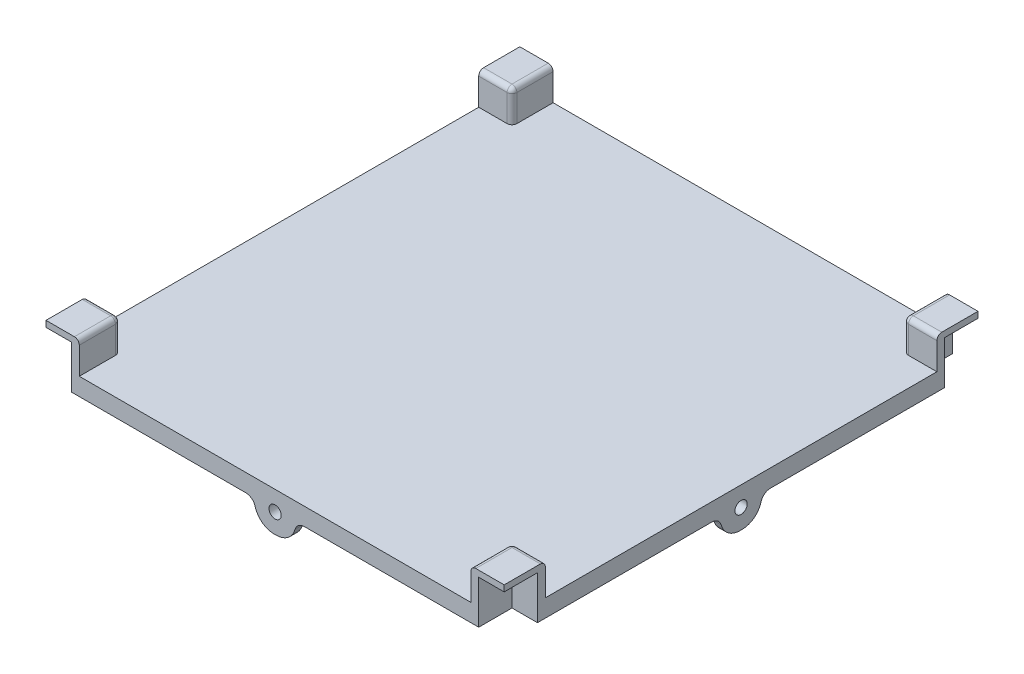
from build123d import *

# Parameters (mm, degrees)
SKETCH2_W                 = 93.6
SKETCH2_H                 = 96.8
BOSS_EXTRUDE2_DEPTH       = 1.6
CUT_EXTRUDE1_DEPTH        = 1.6
CUT_EXTRUDE2_DEPTH        = 1.6
CUT_EXTRUDE3_DEPTH        = 1.6
CUT_EXTRUDE4_DEPTH        = 1.6
SKETCH7_R                 = 15
BOSS_EXTRUDE3_DEPTH       = 1.6
SKETCH8_R                 = 6
CUT_EXTRUDE5_DEPTH        = 1.6
FILLET1_R                 = 2
FILLET2_R                 = 2
SKETCH17_W                = 43.6
SKETCH17_H                = 1.6
BOSS_EXTRUDE4_DEPTH       = 8
CUT_EXTRUDE14_DEPTH       = 1.6
CUT_EXTRUDE15_DEPTH       = 1.6
SKETCH21_W                = 1.6
SKETCH21_H                = 43.6
BOSS_EXTRUDE5_DEPTH       = 8
SKETCH22_W                = 1.6
SKETCH22_H                = 43.6
BOSS_EXTRUDE6_DEPTH       = 8
SKETCH23_W                = 43.6
SKETCH23_H                = 1.6
BOSS_EXTRUDE7_DEPTH       = 8
CUT_EXTRUDE16_DEPTH       = 100
CUT_EXTRUDE17_DEPTH       = 100
CUT_EXTRUDE18_DEPTH       = 100
CUT_EXTRUDE19_DEPTH       = 100
SKETCH28_R                = 2.5
BOSS_EXTRUDE8_DEPTH       = 1.4
BOSS_EXTRUDE9_START       = 1.4
SKETCH29_R                = 2.5
BOSS_EXTRUDE9_DEPTH       = 1.4
SKETCH30_R                = 2.5
BOSS_EXTRUDE10_DEPTH      = 1.4
BOSS_EXTRUDE11_START      = 1.4
SKETCH31_R                = 2.5
BOSS_EXTRUDE11_DEPTH      = 1.4
M3X0_5_TAPPED_HOLE1_D     = 2.5
M3X0_5_TAPPED_HOLE2_D     = 2.5
M3X0_5_TAPPED_HOLE2_DEPTH = 8.5
M3X0_5_TAPPED_HOLE2_TIP   = 0.751075774
M3X0_5_TAPPED_HOLE3_D     = 2.5
M3X0_5_TAPPED_HOLE3_DEPTH = 8.5
M3X0_5_TAPPED_HOLE3_TIP   = 0.751075774
FILLET5_R                 = 5
FILLET6_R                 = 5
FILLET7_R                 = 5
SKETCH39_W                = 50
SKETCH39_H                = 2
CUT_EXTRUDE20_DEPTH       = 100
SKETCH40_W                = 50
SKETCH40_H                = 2
CUT_EXTRUDE21_DEPTH       = 100
FILLET10_R                = 5
FILLET11_R                = 5
BOSS_EXTRUDE12_DEPTH      = 6.5
FILLET12_R                = 1
BOSS_EXTRUDE13_DEPTH      = 6.5
FILLET13_R                = 1
BOSS_EXTRUDE14_DEPTH      = 6.5
BOSS_EXTRUDE15_DEPTH      = 6.5
FILLET14_R                = 1
SKETCH46_W                = 10
SKETCH46_H                = 6
CUT_EXTRUDE23_DEPTH       = 100
SKETCH47_W                = 10
SKETCH47_H                = 6
CUT_EXTRUDE24_DEPTH       = 100
SKETCH48_W                = 10
SKETCH48_H                = 6
CUT_EXTRUDE25_DEPTH       = 100
SKETCH49_W                = 10
SKETCH49_H                = 6
CUT_EXTRUDE26_DEPTH       = 100
CHAMFER1_SIZE             = 5
FILLET15_R                = 5
FILLET16_R                = 5
FILLET17_R                = 5
SKETCH51_W                = 6.8
SKETCH51_H                = 1.25
BOSS_EXTRUDE16_DEPTH      = 5.2
SKETCH52_W                = 6.8
SKETCH52_H                = 1.25
BOSS_EXTRUDE17_DEPTH      = 5.2
SKETCH53_W                = 5.2
SKETCH53_H                = 1.25
BOSS_EXTRUDE18_DEPTH      = 6.8
SKETCH54_W                = 6.8
SKETCH54_H                = 1.25
BOSS_EXTRUDE19_DEPTH      = 5.2
SKETCH55_W                = 5.452266971
SKETCH55_H                = 7.312215573
CUT_EXTRUDE27_DEPTH       = 1.6
SKETCH56_W                = 7.42696381
SKETCH56_H                = 8.768462259
CUT_EXTRUDE28_DEPTH       = 1.6
SKETCH57_W                = 6.622712937
SKETCH57_H                = 11.132324922
CUT_EXTRUDE29_DEPTH       = 1.6
SKETCH58_W                = 8.920588643
SKETCH58_H                = 11.870937258
CUT_EXTRUDE30_DEPTH       = 1.6
SKETCH60_W                = 93.6
SKETCH60_H                = 6
CUT_EXTRUDE31_DEPTH       = 100
BOSS_EXTRUDE20_DEPTH      = 8
SKETCH64_W                = 41.3
SKETCH64_H                = 6
CUT_EXTRUDE32_DEPTH       = 100
SKETCH65_W                = 41.3
SKETCH65_H                = 6
CUT_EXTRUDE33_DEPTH       = 100
SKETCH66_W                = 37.6
SKETCH66_H                = 6
CUT_EXTRUDE34_DEPTH       = 100
SKETCH68_W                = 37.6
SKETCH68_H                = 6
CUT_EXTRUDE35_DEPTH       = 100
FILLET19_R                = 2
SKETCH73_R                = 2.5
BOSS_EXTRUDE21_DEPTH      = 1.4
SKETCH74_R                = 2.5
BOSS_EXTRUDE22_DEPTH      = 1.4
BOSS_EXTRUDE23_START      = 1.4
SKETCH75_R                = 2.5
BOSS_EXTRUDE23_DEPTH      = 1.4
SKETCH76_R                = 2.5
BOSS_EXTRUDE24_DEPTH      = 1.4
SKETCH77_W                = 8
SKETCH77_H                = 1.6
CUT_EXTRUDE40_DEPTH       = 100
SKETCH79_W                = 8
SKETCH79_H                = 1.6
CUT_EXTRUDE41_DEPTH       = 100
FILLET20_R                = 4
M3X0_5_TAPPED_HOLE4_D     = 2.5
M3X0_5_TAPPED_HOLE4_DEPTH = 8.5
M3X0_5_TAPPED_HOLE4_TIP   = 0.751075774
M3X0_5_TAPPED_HOLE5_D     = 2.5
M3X0_5_TAPPED_HOLE5_DEPTH = 8.5
M3X0_5_TAPPED_HOLE5_TIP   = 0.751075774
M3X0_5_TAPPED_HOLE6_D     = 2.5
M3X0_5_TAPPED_HOLE6_DEPTH = 8.5
M3X0_5_TAPPED_HOLE6_TIP   = 0.751075774
M3X0_5_TAPPED_HOLE7_D     = 2.5
M3X0_5_TAPPED_HOLE7_DEPTH = 8.5
M3X0_5_TAPPED_HOLE7_TIP   = 0.751075774
SKETCH88_W                = 75.688433258
SKETCH88_H                = 79.83223405
BOSS_EXTRUDE25_DEPTH      = 1.6


with BuildPart() as part:
    # Sketch2 → Boss-Extrude2 (new body)
    with BuildSketch(Plane(origin=(0, 0, 0), x_dir=(1, 0, 0), z_dir=(0, 1, 0))):
        Rectangle(SKETCH2_W, SKETCH2_H)
    extrude(amount=BOSS_EXTRUDE2_DEPTH)

    # Sketch3 → Cut-Extrude1 (cut)
    with BuildSketch(Plane(origin=(0, 1.6, 0), x_dir=(1, 0, 0), z_dir=(0, 1, 0))):
        Polygon((-30.175405763, 38.4), (30.175405763, 38.4), (0, 7.192956433), align=None)
    extrude(amount=-CUT_EXTRUDE1_DEPTH, mode=Mode.SUBTRACT)

    # Sketch4 → Cut-Extrude2 (cut)
    with BuildSketch(Plane(origin=(0, 1.6, 0), x_dir=(1, 0, 0), z_dir=(0, 1, 0))):
        Polygon((-30.175405763, -38.4), (30.175405763, -38.4), (0, -7.192956433), align=None)
    extrude(amount=-CUT_EXTRUDE2_DEPTH, mode=Mode.SUBTRACT)

    # Sketch5 → Cut-Extrude3 (cut)
    with BuildSketch(Plane(origin=(0, 1.6, 0), x_dir=(1, 0, 0), z_dir=(0, 1, 0))):
        Polygon((36.8, 30.865163225), (36.8, -30.865163225), (6.95517275, 0), align=None)
    extrude(amount=-CUT_EXTRUDE3_DEPTH, mode=Mode.SUBTRACT)

    # Sketch6 → Cut-Extrude4 (cut)
    with BuildSketch(Plane(origin=(0, 1.6, 0), x_dir=(1, 0, 0), z_dir=(0, 1, 0))):
        Polygon((-36.8, 30.865163225), (-36.8, -30.865163225), (-6.95517275, 0), align=None)
    extrude(amount=-CUT_EXTRUDE4_DEPTH, mode=Mode.SUBTRACT)

    # Sketch7 → Boss-Extrude3 (add)
    with BuildSketch(Plane(origin=(0, 1.6, 0), x_dir=(1, 0, 0), z_dir=(0, 1, 0))):
        Circle(SKETCH7_R)
    extrude(amount=-BOSS_EXTRUDE3_DEPTH)

    # Sketch8 → Cut-Extrude5 (cut)
    with BuildSketch(Plane(origin=(0, 1.6, 0), x_dir=(1, 0, 0), z_dir=(0, 1, 0))):
        with Locations(Location((0, 0, 0), (0, 0, 270))):
            Circle(SKETCH8_R)
    extrude(amount=-CUT_EXTRUDE5_DEPTH, mode=Mode.SUBTRACT)

    # Fillet1
    fillet1_edges = [part.edges().sort_by_distance(p)[0] for p in [
        (30.175405763, 0.8, -38.4),
        (-30.175405763, 0.8, -38.4),
        (-30.175405763, 0.8, 38.4),
        (30.175405763, 0.8, 38.4),
        (36.8, 0.8, -30.865163225),
        (36.8, 0.8, 30.865163225),
        (-36.8, 0.8, -30.865163225),
        (-36.8, 0.8, 30.865163225),
        (-13.424991499, 0.8, 6.691009135),
        (6.236097449, 0.8, -13.642253795),
        (13.424991499, 0.8, -6.691009135),
        (-6.236097449, 0.8, 13.642253795),
        (-6.236097449, 0.8, -13.642253795),
        (-13.424991499, 0.8, -6.691009135),
        (6.236097449, 0.8, 13.642253795),
        (13.424991499, 0.8, 6.691009135),
    ]]
    fillet(fillet1_edges, radius=FILLET1_R)

    # Fillet2
    fillet2_edges = [part.edges().sort_by_distance(p)[0] for p in [
        (46.8, 0.8, 48.4),
        (-46.8, 0.8, 48.4),
        (-46.8, 0.8, -48.4),
        (46.8, 0.8, -48.4),
    ]]
    fillet(fillet2_edges, radius=FILLET2_R)

    # Sketch17 → Boss-Extrude4 (add)
    with BuildSketch(Plane.XZ):
        with Locations((0, 47.6)):
            Rectangle(SKETCH17_W, SKETCH17_H)
    extrude(amount=BOSS_EXTRUDE4_DEPTH)

    # Sketch18 → Cut-Extrude14 (cut)
    with BuildSketch(Plane.XY.offset(48.4)):
        Polygon((-21.8, 0), (-21.8, -8), (-13.8, -8), align=None)
    extrude(amount=-CUT_EXTRUDE14_DEPTH, mode=Mode.SUBTRACT)

    # Sketch19 → Cut-Extrude15 (cut)
    with BuildSketch(Plane.XY.offset(48.4)):
        Polygon((21.8, 0), (21.8, -8), (13.8, -8), align=None)
    extrude(amount=-CUT_EXTRUDE15_DEPTH, mode=Mode.SUBTRACT)

    # Sketch21 → Boss-Extrude5 (add)
    with BuildSketch(Plane.XZ):
        with Locations((-46, 0)):
            Rectangle(SKETCH21_W, SKETCH21_H)
    extrude(amount=BOSS_EXTRUDE5_DEPTH)

    # Sketch22 → Boss-Extrude6 (add)
    with BuildSketch(Plane.XZ):
        with Locations((46, 0)):
            Rectangle(SKETCH22_W, SKETCH22_H)
    extrude(amount=BOSS_EXTRUDE6_DEPTH)

    # Sketch23 → Boss-Extrude7 (add)
    with BuildSketch(Plane.XZ):
        with Locations((0, -47.6)):
            Rectangle(SKETCH23_W, SKETCH23_H)
    extrude(amount=BOSS_EXTRUDE7_DEPTH)

    # Sketch24 → Cut-Extrude16 (cut)
    with BuildSketch(Plane(origin=(46.8, 0, 0), x_dir=(0, 0, -1), z_dir=(1, 0, 0))):
        Polygon((-21.8, 0), (-13.8, -8), (-21.8, -8), align=None)
    extrude(amount=-CUT_EXTRUDE16_DEPTH, mode=Mode.SUBTRACT)

    # Sketch25 → Cut-Extrude17 (cut)
    with BuildSketch(Plane(origin=(46.8, 0, 0), x_dir=(0, 0, -1), z_dir=(1, 0, 0))):
        Polygon((21.8, 0), (13.8, -8), (21.8, -8), align=None)
    extrude(amount=-CUT_EXTRUDE17_DEPTH, mode=Mode.SUBTRACT)

    # Sketch26 → Cut-Extrude18 (cut)
    with BuildSketch(Plane(origin=(0, 0, -48.4), x_dir=(-1, 0, 0), z_dir=(0, 0, -1))):
        Polygon((-21.8, 0), (-13.8, -8), (-21.8, -8), align=None)
    extrude(amount=-CUT_EXTRUDE18_DEPTH, mode=Mode.SUBTRACT)

    # Sketch27 → Cut-Extrude19 (cut)
    with BuildSketch(Plane(origin=(0, 0, -48.4), x_dir=(-1, 0, 0), z_dir=(0, 0, -1))):
        Polygon((21.8, 0), (13.8, -8), (21.8, -8), align=None)
    extrude(amount=-CUT_EXTRUDE19_DEPTH, mode=Mode.SUBTRACT)

    # Sketch28 → Boss-Extrude8 (add)
    with BuildSketch(Plane(origin=(-45.2, 0, 0), x_dir=(0, 0, -1), z_dir=(1, 0, 0))):
        with Locations((0, -2.4)):
            Circle(SKETCH28_R)
    extrude(amount=BOSS_EXTRUDE8_DEPTH)

    # Sketch29 → Boss-Extrude9 (add)
    with BuildSketch(Plane.ZY.offset(-45.2).offset(BOSS_EXTRUDE9_START)):
        with Locations((0, -2.4)):
            Circle(SKETCH29_R)
    extrude(amount=-BOSS_EXTRUDE9_DEPTH)

    # Sketch30 → Boss-Extrude10 (add)
    with BuildSketch(Plane.XY.offset(-46.8)):
        with Locations((0, -2.4)):
            Circle(SKETCH30_R)
    extrude(amount=BOSS_EXTRUDE10_DEPTH)

    # Sketch31 → Boss-Extrude11 (add)
    with BuildSketch(Plane(origin=(0, 0, 46.8), x_dir=(-1, 0, 0), z_dir=(0, 0, -1)).offset(BOSS_EXTRUDE11_START)):
        with Locations((0, -2.4)):
            Circle(SKETCH31_R)
    extrude(amount=-BOSS_EXTRUDE11_DEPTH)

    # M3x0.5 Tapped Hole1 (through all)
    with Locations(Plane.XY.offset(48.4)):
        with Locations((0, -2.4)):
            Hole(M3X0_5_TAPPED_HOLE1_D / 2)

    # M3x0.5 Tapped Hole2
    with Locations(Plane(origin=(46.8, 0, 0), x_dir=(0, 0, -1), z_dir=(1, 0, 0))):
        with Locations((0, -2.4)):
            Hole(M3X0_5_TAPPED_HOLE2_D / 2, depth=M3X0_5_TAPPED_HOLE2_DEPTH)
            with Locations((0, 0, -(M3X0_5_TAPPED_HOLE2_DEPTH + M3X0_5_TAPPED_HOLE2_TIP / 2))):  # 118° drill point
                Cone(0, M3X0_5_TAPPED_HOLE2_D / 2, M3X0_5_TAPPED_HOLE2_TIP, mode=Mode.SUBTRACT)

    # M3x0.5 Tapped Hole3
    with Locations(Plane.ZY.offset(46.8)):
        with Locations((0, -2.4)):
            Hole(M3X0_5_TAPPED_HOLE3_D / 2, depth=M3X0_5_TAPPED_HOLE3_DEPTH)
            with Locations((0, 0, -(M3X0_5_TAPPED_HOLE3_DEPTH + M3X0_5_TAPPED_HOLE3_TIP / 2))):  # 118° drill point
                Cone(0, M3X0_5_TAPPED_HOLE3_D / 2, M3X0_5_TAPPED_HOLE3_TIP, mode=Mode.SUBTRACT)

    # Fillet5
    fillet5_edges = [part.edges().sort_by_distance(p)[0] for p in [
        (13.8, -8, 47.6),
    ]]
    fillet(fillet5_edges, radius=FILLET5_R)

    # Fillet6
    fillet6_edges = [part.edges().sort_by_distance(p)[0] for p in [
        (-13.8, -8, 47.6),
    ]]
    fillet(fillet6_edges, radius=FILLET6_R)

    # Fillet7
    fillet7_edges = [part.edges().sort_by_distance(p)[0] for p in [
        (-46, -8, 13.8),
    ]]
    fillet(fillet7_edges, radius=FILLET7_R)

    # Sketch39 → Cut-Extrude20 (cut)
    with BuildSketch(Plane.XY.offset(48.4)):
        with Locations((0, -7)):
            Rectangle(SKETCH39_W, SKETCH39_H)
    extrude(amount=-CUT_EXTRUDE20_DEPTH, mode=Mode.SUBTRACT)

    # Sketch40 → Cut-Extrude21 (cut)
    with BuildSketch(Plane(origin=(46.8, 0, 0), x_dir=(0, 0, -1), z_dir=(1, 0, 0))):
        with Locations((0, -7)):
            Rectangle(SKETCH40_W, SKETCH40_H)
    extrude(amount=-CUT_EXTRUDE21_DEPTH, mode=Mode.SUBTRACT)

    # Fillet10
    fillet10_edges = [part.edges().sort_by_distance(p)[0] for p in [
        (46, -6, 15.8),
        (46, -6, -15.8),
    ]]
    fillet(fillet10_edges, radius=FILLET10_R)

    # Fillet11
    fillet11_edges = [part.edges().sort_by_distance(p)[0] for p in [
        (-15.8, -6, -47.6),
        (-15.8, -6, 47.6),
        (15.8, -6, 47.6),
        (15.8, -6, -47.6),
        (-46, -6, -15.8),
        (-46, -6, 15.8),
    ]]
    fillet(fillet11_edges, radius=FILLET11_R)

    # Sketch41 → Boss-Extrude12 (add)
    with BuildSketch(Plane(origin=(0, 1.6, 0), x_dir=(1, 0, 0), z_dir=(0, 1, 0))):
        Polygon((-46.8, 41.6), (-41.6, 41.6), (-41.6, 48.4), (-40, 48.4), (-40, 40), (-46.8, 40), align=None)
    extrude(amount=BOSS_EXTRUDE12_DEPTH)

    # Fillet12
    fillet12_edges = [part.edges().sort_by_distance(p)[0] for p in [
        (-40, 4.85, -40),
        (-43.4, 8.1, -40),
        (-40, 8.1, -44.2),
    ]]
    fillet(fillet12_edges, radius=FILLET12_R)

    # Sketch42 → Boss-Extrude13 (add)
    with BuildSketch(Plane(origin=(0, 1.6, 0), x_dir=(1, 0, 0), z_dir=(0, 1, 0))):
        Polygon((41.6, 48.4), (41.6, 41.6), (46.8, 41.6), (46.8, 40), (40, 40), (40, 48.4), align=None)
    extrude(amount=BOSS_EXTRUDE13_DEPTH)

    # Fillet13
    fillet13_edges = [part.edges().sort_by_distance(p)[0] for p in [
        (40, 4.85, -40),
        (40, 8.1, -44.2),
        (43.4, 8.1, -40),
    ]]
    fillet(fillet13_edges, radius=FILLET13_R)

    # Sketch43 → Boss-Extrude14 (add)
    with BuildSketch(Plane(origin=(0, 1.6, 0), x_dir=(1, 0, 0), z_dir=(0, 1, 0))):
        Polygon((-46.8, -41.6), (-41.6, -41.6), (-41.6, -48.4), (-40, -48.4), (-40, -40), (-46.8, -40), align=None)
    extrude(amount=BOSS_EXTRUDE14_DEPTH)

    # Sketch44 → Boss-Extrude15 (add)
    with BuildSketch(Plane(origin=(0, 1.6, 0), x_dir=(1, 0, 0), z_dir=(0, 1, 0))):
        Polygon((46.8, -41.6), (41.6, -41.6), (41.6, -48.4), (40, -48.4), (40, -40), (46.8, -40), align=None)
    extrude(amount=BOSS_EXTRUDE15_DEPTH)

    # Fillet14
    fillet14_edges = [part.edges().sort_by_distance(p)[0] for p in [
        (-40, 4.85, 40),
        (-40, 8.1, 44.2),
        (-43.4, 8.1, 40),
        (40, 4.85, 40),
        (43.4, 8.1, 40),
        (40, 8.1, 44.2),
    ]]
    fillet(fillet14_edges, radius=FILLET14_R)

    # Sketch46 → Cut-Extrude23 (cut)
    with BuildSketch(Plane.XY.offset(48.4)):
        with Locations((16.8, -3)):
            Rectangle(SKETCH46_W, SKETCH46_H)
    extrude(amount=-CUT_EXTRUDE23_DEPTH, mode=Mode.SUBTRACT)

    # Sketch47 → Cut-Extrude24 (cut)
    with BuildSketch(Plane.XY.offset(48.4)):
        with Locations((-16.8, -3)):
            Rectangle(SKETCH47_W, SKETCH47_H)
    extrude(amount=-CUT_EXTRUDE24_DEPTH, mode=Mode.SUBTRACT)

    # Sketch48 → Cut-Extrude25 (cut)
    with BuildSketch(Plane(origin=(46.8, 0, 0), x_dir=(0, 0, -1), z_dir=(1, 0, 0))):
        with Locations((-16.8, -3)):
            Rectangle(SKETCH48_W, SKETCH48_H)
    extrude(amount=-CUT_EXTRUDE25_DEPTH, mode=Mode.SUBTRACT)

    # Sketch49 → Cut-Extrude26 (cut)
    with BuildSketch(Plane(origin=(46.8, 0, 0), x_dir=(0, 0, -1), z_dir=(1, 0, 0))):
        with Locations((16.8, -3)):
            Rectangle(SKETCH49_W, SKETCH49_H)
    extrude(amount=-CUT_EXTRUDE26_DEPTH, mode=Mode.SUBTRACT)

    # Chamfer1
    chamfer1_edges = [part.edges().sort_by_distance(p)[0] for p in [
        (11.8, -6, 47.6),
        (11.8, -6, -47.6),
        (-11.8, -6, 47.6),
        (-11.8, -6, -47.6),
        (46, -6, 11.8),
        (-46, -6, 11.8),
        (46, -6, -11.8),
        (-46, -6, -11.8),
    ]]
    chamfer(chamfer1_edges, length=CHAMFER1_SIZE)

    # Fillet15
    # the kernel refuses this fillet: 5 mm, written as the material it adds along each edge
    with BuildSketch(Plane(origin=(46.8, 0, 11.8), x_dir=(0, -1, 0), z_dir=(-1, 0, 0))) as fillet15_piece_1:
        with BuildLine():
            CenterArc((5, 3), FILLET15_R, 180, 36.869897646)
            Line((0, 3), (0, 0))
            Line((0, 0), (1, 0))
        make_face()
    extrude(amount=1.6)

    # Fillet16
    # the kernel refuses this fillet: 5 mm, written as the material it adds along each edge
    with BuildSketch(Plane(origin=(11.8, 0, 48.4), x_dir=(0, -1, 0), z_dir=(0, 0, -1)), Plane(origin=(-45.2, 0, -11.8), x_dir=(0, -1, 0), z_dir=(-1, 0, 0)), Plane(origin=(11.8, 0, -46.8), x_dir=(0, -1, 0), z_dir=(0, 0, -1)), Plane(origin=(46.8, 0, -11.8), x_dir=(0, -1, 0), z_dir=(-1, 0, 0))) as fillet16_piece_1:
        with BuildLine():
            CenterArc((5, -3), FILLET16_R, 143.130102354, 36.869897646)
            Line((0, -3), (0, 0))
            Line((0, 0), (1, 0))
        make_face()
    extrude(amount=1.6)
    with BuildSketch(Plane(origin=(-11.8, 0, 48.4), x_dir=(0, -1, 0), z_dir=(0, 0, -1)), Plane(origin=(-45.2, 0, 11.8), x_dir=(0, -1, 0), z_dir=(-1, 0, 0)), Plane(origin=(-11.8, 0, -46.8), x_dir=(0, -1, 0), z_dir=(0, 0, -1))) as fillet16_piece_2:
        with BuildLine():
            CenterArc((5, 3), FILLET16_R, 180, 36.869897646)
            Line((0, 3), (0, 0))
            Line((0, 0), (1, 0))
        make_face()
    extrude(amount=1.6)

    # Fillet17
    fillet17_edges = [part.edges().sort_by_distance(p)[0] for p in [
        (46, -6, -6.8),
        (46, -6, 6.8),
        (6.8, -6, -47.6),
        (-6.8, -6, -47.6),
        (-46, -6, 6.8),
        (-46, -6, -6.8),
        (-6.8, -6, 47.6),
        (6.8, -6, 47.6),
    ]]
    fillet(fillet17_edges, radius=FILLET17_R)

    # Sketch51 → Boss-Extrude16 (add)
    with BuildSketch(Plane(origin=(41.6, 0, 0), x_dir=(0, 0, -1), z_dir=(1, 0, 0))):
        with Locations((-45, 7.475)):
            Rectangle(SKETCH51_W, SKETCH51_H)
    extrude(amount=BOSS_EXTRUDE16_DEPTH)

    # Sketch52 → Boss-Extrude17 (add)
    with BuildSketch(Plane(origin=(41.6, 0, 0), x_dir=(0, 0, -1), z_dir=(1, 0, 0))):
        with Locations((45, 7.475)):
            Rectangle(SKETCH52_W, SKETCH52_H)
    extrude(amount=BOSS_EXTRUDE17_DEPTH)

    # Sketch53 → Boss-Extrude18 (add)
    with BuildSketch(Plane.XY.offset(41.6)):
        with Locations((-44.2, 7.475)):
            Rectangle(SKETCH53_W, SKETCH53_H)
    extrude(amount=BOSS_EXTRUDE18_DEPTH)

    # Sketch54 → Boss-Extrude19 (add)
    with BuildSketch(Plane.ZY.offset(41.6)):
        with Locations((-45, 7.475)):
            Rectangle(SKETCH54_W, SKETCH54_H)
    extrude(amount=BOSS_EXTRUDE19_DEPTH)

    # Sketch55 → Cut-Extrude27 (cut)
    with BuildSketch(Plane(origin=(0, 1.6, 0), x_dir=(1, 0, 0), z_dir=(0, 1, 0))):
        with Locations((44.326133486, -45.256107787)):
            Rectangle(SKETCH55_W, SKETCH55_H)
    extrude(amount=-CUT_EXTRUDE27_DEPTH, mode=Mode.SUBTRACT)

    # Sketch56 → Cut-Extrude28 (cut)
    with BuildSketch(Plane(origin=(0, 1.6, 0), x_dir=(1, 0, 0), z_dir=(0, 1, 0))):
        with Locations((-45.313481905, -45.98423113)):
            Rectangle(SKETCH56_W, SKETCH56_H)
    extrude(amount=-CUT_EXTRUDE28_DEPTH, mode=Mode.SUBTRACT)

    # Sketch57 → Cut-Extrude29 (cut)
    with BuildSketch(Plane(origin=(0, 1.6, 0), x_dir=(1, 0, 0), z_dir=(0, 1, 0))):
        with Locations((44.911356469, 47.166162461)):
            Rectangle(SKETCH57_W, SKETCH57_H)
    extrude(amount=-CUT_EXTRUDE29_DEPTH, mode=Mode.SUBTRACT)

    # Sketch58 → Cut-Extrude30 (cut)
    with BuildSketch(Plane(origin=(0, 1.6, 0), x_dir=(1, 0, 0), z_dir=(0, 1, 0))):
        with Locations((-46.060294322, 47.535468629)):
            Rectangle(SKETCH58_W, SKETCH58_H)
    extrude(amount=-CUT_EXTRUDE30_DEPTH, mode=Mode.SUBTRACT)

    # Sketch60 → Cut-Extrude31 (cut)
    with BuildSketch(Plane.XY.offset(48.4)):
        with Locations((0, -3)):
            Rectangle(SKETCH60_W, SKETCH60_H)
    extrude(amount=-CUT_EXTRUDE31_DEPTH, mode=Mode.SUBTRACT)

    # Sketch62 → Boss-Extrude20 (add)
    with BuildSketch(Plane.XZ):
        Polygon((-41.6, 48.4), (-41.6, 41.6), (-46.8, 41.6), (-46.8, -41.6), (-41.6, -41.6), (-41.6, -48.4), (41.6, -48.4), (41.6, -41.6), (46.8, -41.6), (46.8, 41.6), (41.6, 41.6), (41.6, 48.4), align=None)
        Polygon((-40.1, 46.9), (-40.1, 40.1), (-45.3, 40.1), (-45.3, -40.1), (-40.1, -40.1), (-40.1, -46.9), (40.1, -46.9), (40.1, -40.1), (41.6, -40.1), (45.3, -40.1), (45.3, 40.1), (40.1, 40.1), (40.1, 46.9), align=None, mode=Mode.SUBTRACT)
    extrude(amount=BOSS_EXTRUDE20_DEPTH)

    # Sketch64 → Cut-Extrude32 (cut)
    with BuildSketch(Plane.XY.offset(48.4)):
        with Locations((-24.65, -5)):
            Rectangle(SKETCH64_W, SKETCH64_H)
    extrude(amount=-CUT_EXTRUDE32_DEPTH, mode=Mode.SUBTRACT)

    # Sketch65 → Cut-Extrude33 (cut)
    with BuildSketch(Plane.XY.offset(48.4)):
        with Locations((24.65, -5)):
            Rectangle(SKETCH65_W, SKETCH65_H)
    extrude(amount=-CUT_EXTRUDE33_DEPTH, mode=Mode.SUBTRACT)

    # Sketch66 → Cut-Extrude34 (cut)
    with BuildSketch(Plane(origin=(46.8, 0, 0), x_dir=(0, 0, -1), z_dir=(1, 0, 0))):
        with Locations((-22.8, -5)):
            Rectangle(SKETCH66_W, SKETCH66_H)
    extrude(amount=-CUT_EXTRUDE34_DEPTH, mode=Mode.SUBTRACT)

    # Sketch68 → Cut-Extrude35 (cut)
    with BuildSketch(Plane(origin=(46.8, 0, 0), x_dir=(0, 0, -1), z_dir=(1, 0, 0))):
        with Locations((22.8, -5)):
            Rectangle(SKETCH68_W, SKETCH68_H)
    extrude(amount=-CUT_EXTRUDE35_DEPTH, mode=Mode.SUBTRACT)

    # Fillet19
    fillet19_edges = [part.edges().sort_by_distance(p)[0] for p in [
        (-4, -2, -47.65),
        (-4, -2, 47.65),
        (4, -2, 47.65),
        (4, -2, -47.65),
        (-46.05, -2, 4),
        (46.05, -2, 4),
        (-46.05, -2, -4),
        (46.05, -2, -4),
    ]]
    fillet(fillet19_edges, radius=FILLET19_R)

    # Sketch73 → Boss-Extrude21 (add)
    with BuildSketch(Plane(origin=(-45.3, 0, 0), x_dir=(0, 0, -1), z_dir=(1, 0, 0))):
        with Locations((0, -2.4)):
            Circle(SKETCH73_R)
    extrude(amount=BOSS_EXTRUDE21_DEPTH)

    # Sketch74 → Boss-Extrude22 (add)
    with BuildSketch(Plane.XY.offset(-46.9)):
        with Locations((0, -2.4)):
            Circle(SKETCH74_R)
    extrude(amount=BOSS_EXTRUDE22_DEPTH)

    # Sketch75 → Boss-Extrude23 (add)
    with BuildSketch(Plane(origin=(0, 0, 46.9), x_dir=(-1, 0, 0), z_dir=(0, 0, -1)).offset(BOSS_EXTRUDE23_START)):
        with Locations((0, -2.4)):
            Circle(SKETCH75_R)
    extrude(amount=-BOSS_EXTRUDE23_DEPTH)

    # Sketch76 → Boss-Extrude24 (add)
    with BuildSketch(Plane.ZY.offset(-45.3)):
        with Locations((0, -2.25000044)):
            Circle(SKETCH76_R)
    extrude(amount=BOSS_EXTRUDE24_DEPTH)

    # Sketch77 → Cut-Extrude40 (cut)
    with BuildSketch(Plane.XY.offset(48.4)):
        with Locations((0, -7.2)):
            Rectangle(SKETCH77_W, SKETCH77_H)
    extrude(amount=-CUT_EXTRUDE40_DEPTH, mode=Mode.SUBTRACT)

    # Sketch79 → Cut-Extrude41 (cut)
    with BuildSketch(Plane(origin=(46.8, 0, 0), x_dir=(0, 0, -1), z_dir=(1, 0, 0))):
        with Locations((0, -7.2)):
            Rectangle(SKETCH79_W, SKETCH79_H)
    extrude(amount=-CUT_EXTRUDE41_DEPTH, mode=Mode.SUBTRACT)

    # Fillet20
    fillet20_edges = [part.edges().sort_by_distance(p)[0] for p in [
        (-46.05, -6.4, 4),
        (-46.05, -6.4, -4),
        (-4, -6.4, -47.65),
        (4, -6.4, -47.65),
        (-4, -6.4, 47.65),
        (4, -6.4, 47.65),
        (46.05, -6.4, 4),
        (46.05, -6.4, -4),
    ]]
    fillet(fillet20_edges, radius=FILLET20_R)

    # M3x0.5 Tapped Hole4
    with Locations(Plane.XY.offset(48.4)):
        with Locations((0, -2.4)):
            Hole(M3X0_5_TAPPED_HOLE4_D / 2, depth=M3X0_5_TAPPED_HOLE4_DEPTH)
            with Locations((0, 0, -(M3X0_5_TAPPED_HOLE4_DEPTH + M3X0_5_TAPPED_HOLE4_TIP / 2))):  # 118° drill point
                Cone(0, M3X0_5_TAPPED_HOLE4_D / 2, M3X0_5_TAPPED_HOLE4_TIP, mode=Mode.SUBTRACT)

    # M3x0.5 Tapped Hole5
    with Locations(Plane(origin=(46.8, 0, 0), x_dir=(0, 0, -1), z_dir=(1, 0, 0))):
        with Locations((0, -2.4)):
            Hole(M3X0_5_TAPPED_HOLE5_D / 2, depth=M3X0_5_TAPPED_HOLE5_DEPTH)
            with Locations((0, 0, -(M3X0_5_TAPPED_HOLE5_DEPTH + M3X0_5_TAPPED_HOLE5_TIP / 2))):  # 118° drill point
                Cone(0, M3X0_5_TAPPED_HOLE5_D / 2, M3X0_5_TAPPED_HOLE5_TIP, mode=Mode.SUBTRACT)

    # M3x0.5 Tapped Hole6
    with Locations(Plane(origin=(0, 0, -48.4), x_dir=(-1, 0, 0), z_dir=(0, 0, -1))):
        with Locations((0, -2.4)):
            Hole(M3X0_5_TAPPED_HOLE6_D / 2, depth=M3X0_5_TAPPED_HOLE6_DEPTH)
            with Locations((0, 0, -(M3X0_5_TAPPED_HOLE6_DEPTH + M3X0_5_TAPPED_HOLE6_TIP / 2))):  # 118° drill point
                Cone(0, M3X0_5_TAPPED_HOLE6_D / 2, M3X0_5_TAPPED_HOLE6_TIP, mode=Mode.SUBTRACT)

    # M3x0.5 Tapped Hole7
    with Locations(Plane.ZY.offset(46.8)):
        with Locations((0, -2.4)):
            Hole(M3X0_5_TAPPED_HOLE7_D / 2, depth=M3X0_5_TAPPED_HOLE7_DEPTH)
            with Locations((0, 0, -(M3X0_5_TAPPED_HOLE7_DEPTH + M3X0_5_TAPPED_HOLE7_TIP / 2))):  # 118° drill point
                Cone(0, M3X0_5_TAPPED_HOLE7_D / 2, M3X0_5_TAPPED_HOLE7_TIP, mode=Mode.SUBTRACT)

    # Sketch88 → Boss-Extrude25 (add)
    with BuildSketch(Plane(origin=(0, 1.6, 0), x_dir=(1, 0, 0), z_dir=(0, 1, 0))):
        Rectangle(SKETCH88_W, SKETCH88_H)
    extrude(amount=-BOSS_EXTRUDE25_DEPTH)


solid = part.part
